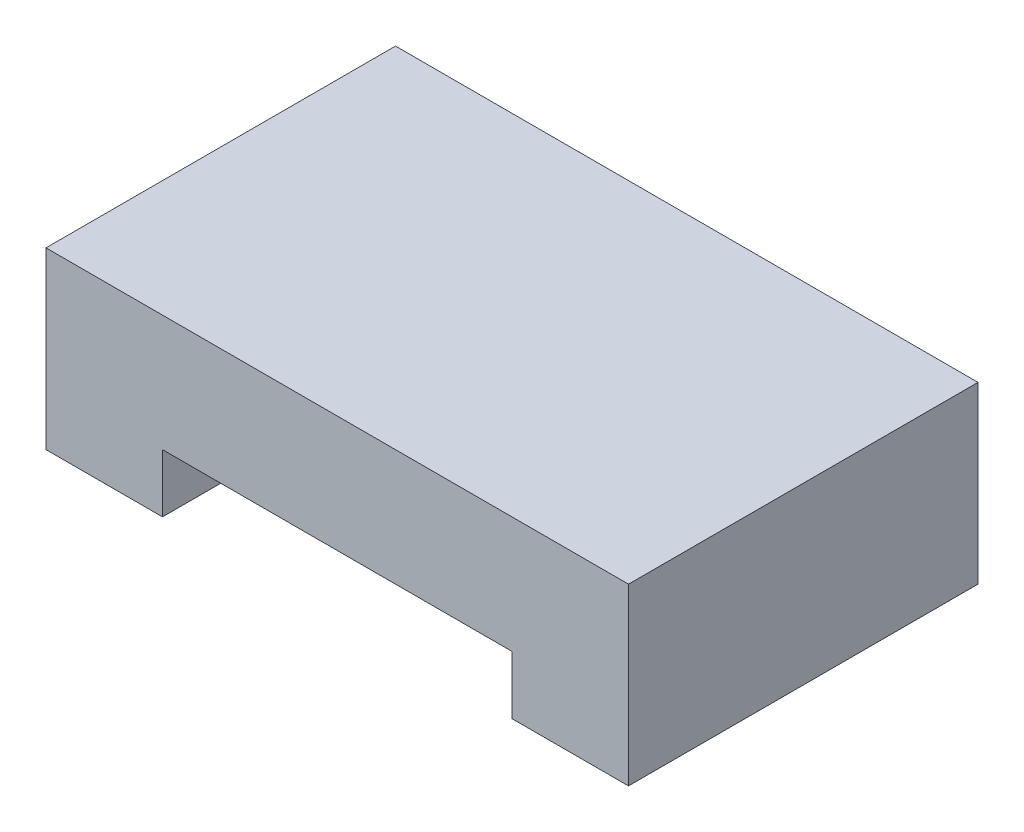
from build123d import *

# Parameters (mm, degrees)
SKETCH1_W           = 5
SKETCH1_H           = 3
BOSS_EXTRUDE1_DEPTH = 1
SKETCH2_W           = 1
SKETCH2_H           = 3
BOSS_EXTRUDE2_DEPTH = 1
CHAMFER1_SIZE       = 0.5


with BuildPart() as part:
    # Sketch1 → Boss-Extrude1 (new body)
    with BuildSketch(Plane(origin=(0, 0, 0), x_dir=(1, 0, 0), z_dir=(0, 1, 0))):
        Rectangle(SKETCH1_W, SKETCH1_H)
    extrude(amount=BOSS_EXTRUDE1_DEPTH)

    # Sketch2 → Boss-Extrude2 (add)
    with BuildSketch(Plane.XZ):
        with Locations((-2, 0)):
            Rectangle(SKETCH2_W, SKETCH2_H)
        with Locations((2, 0)):
            Rectangle(SKETCH2_W, SKETCH2_H)
    extrude(amount=BOSS_EXTRUDE2_DEPTH)

    # Chamfer1
    chamfer1_edges = [part.edges().sort_by_distance(p)[0] for p in [
        (-2.5, -1, 0),
        (-2, -1, -1.5),
        (-1.5, -1, 0),
        (-2, -1, 1.5),
        (2.5, -1, 0),
        (2, -1, 1.5),
        (1.5, -1, 0),
        (2, -1, -1.5),
    ]]
    chamfer(chamfer1_edges, length=CHAMFER1_SIZE - 0.0001)  # a hair under: the kernel refuses the full size


solid = part.part
